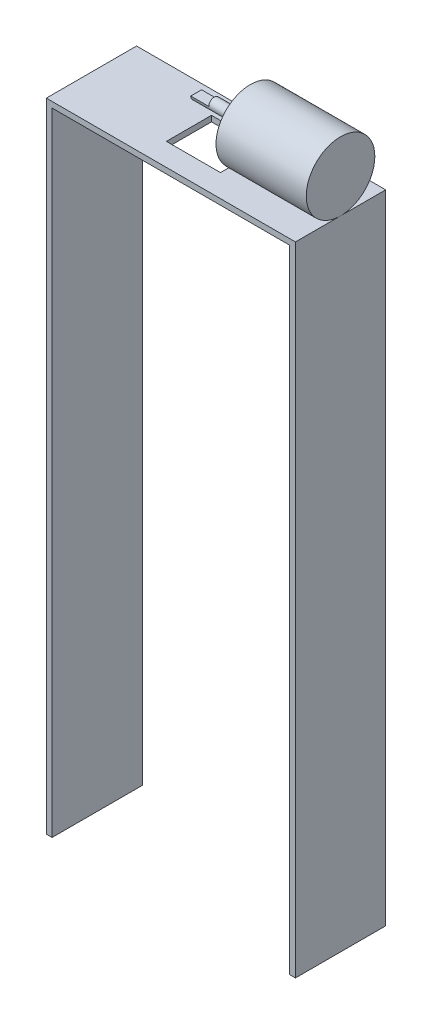
from build123d import *

# Parameters (mm, degrees)
SKETCH2_W             = 3.175
SKETCH2_H             = 50
BOSS_EXTRUDE1_DEPTH   = 350
BOSS_EXTRUDE1_2_DEPTH = 350
SKETCH3_W             = 138
SKETCH3_H             = 50
BOSS_EXTRUDE2_DEPTH   = 3.175
CUT_EXTRUDE1_REACH    = 384.461
SKETCH4_W             = 30
SKETCH4_H             = 25
SKETCH5_R             = 19
BOSS_EXTRUDE3_DEPTH   = 50
SKETCH6_R             = 3
BOSS_EXTRUDE4_DEPTH   = 30
SKETCH7_W             = 6
SKETCH7_H             = 3
CUT_EXTRUDE2_DEPTH    = 10


with BuildPart() as part:
    # Sketch2 → Boss-Extrude1 (new body)
    with BuildSketch(Plane(origin=(0, 0, 0), x_dir=(1, 0, 0), z_dir=(0, 1, 0))):
        with Locations((1.5875, 25)):
            Rectangle(SKETCH2_W, SKETCH2_H)
    extrude(amount=BOSS_EXTRUDE1_DEPTH)



with BuildPart() as body_2:
    # Sketch2 → Boss-Extrude1 2 (new body)
    with BuildSketch(Plane(origin=(0, 0, 0), x_dir=(1, 0, 0), z_dir=(0, 1, 0))):
        with Locations((136.4125, 25)):
            Rectangle(SKETCH2_W, SKETCH2_H)
    extrude(amount=BOSS_EXTRUDE1_2_DEPTH)


with BuildPart() as part_1:
    add(part.part)

    add(body_2.part)  # Boss-Extrude2 merges body 2
    # Sketch3 → Boss-Extrude2 (add)
    with BuildSketch(Plane(origin=(0, 350, 0), x_dir=(1, 0, 0), z_dir=(0, 1, 0))):
        with Locations((69, 25)):
            Rectangle(SKETCH3_W, SKETCH3_H)
    extrude(amount=BOSS_EXTRUDE2_DEPTH)

    # Sketch4 → Cut-Extrude1 (cut, up to next)
    with BuildSketch(Plane(origin=(0, 353.175, 0), x_dir=(1, 0, 0), z_dir=(0, 1, 0)), mode=Mode.PRIVATE) as cut_extrude1_sk1:
        with Locations((69, 25)):
            Rectangle(SKETCH4_W, SKETCH4_H)
    cut_extrude1_tool1 = extrude(cut_extrude1_sk1.sketch, amount=-CUT_EXTRUDE1_REACH, mode=Mode.PRIVATE) & part_1.part
    add(cut_extrude1_tool1.solids().sort_by_distance((69, 353.175, -25))[0], mode=Mode.SUBTRACT)


with BuildPart() as body_2_2:
    # Sketch5 → Boss-Extrude3 (new body)
    with BuildSketch(Plane(origin=(138, 0, 0), x_dir=(0, 0, -1), z_dir=(1, 0, 0))):
        with Locations((25, 372.175)):
            Circle(SKETCH5_R)
    extrude(amount=-BOSS_EXTRUDE3_DEPTH)

    # Sketch6 → Boss-Extrude4 (add)
    with BuildSketch(Plane.ZY.offset(-88)):
        with Locations((-25, 372.175)):
            Circle(SKETCH6_R)
    extrude(amount=BOSS_EXTRUDE4_DEPTH)

    # Sketch7 → Cut-Extrude2 (cut)
    with BuildSketch(Plane.ZY.offset(-58)):
        with Locations((-25, 373.675)):
            Rectangle(SKETCH7_W, SKETCH7_H)
    extrude(amount=-CUT_EXTRUDE2_DEPTH, mode=Mode.SUBTRACT)


solid = Compound([part_1.part, body_2_2.part])
